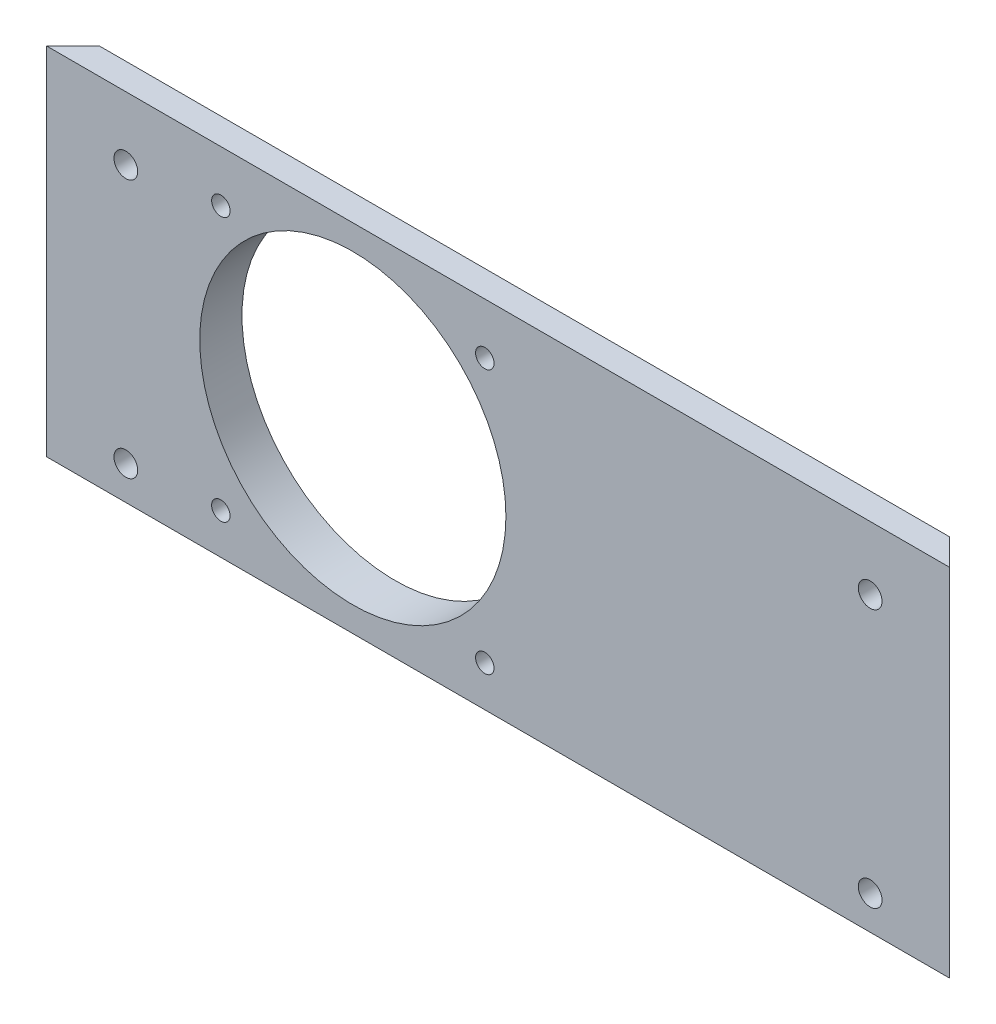
from build123d import *

# Parameters (mm, degrees)
SKETCH1_W           = 171
SKETCH1_H           = 70
SKETCH1_R           = 2.25
BOSS_EXTRUDE1_DEPTH = 5
SKETCH2_W           = 171
SKETCH2_H           = 65
SKETCH2_R           = 2.25
BOSS_EXTRUDE2_DEPTH = 3
CHAMFER1_SIZE       = 8
CHAMFER3_SIZE       = 3
SKETCH3_W           = 7.071067812
SKETCH3_H           = 2.6
CUT_EXTRUDE1_DEPTH  = 199.002168661
SKETCH4_R           = 29
SKETCH4_R_2         = 1.75
CUT_EXTRUDE2_DEPTH  = 185.945938047


with BuildPart() as part:
    # Sketch1 → Boss-Extrude1 (new body)
    with BuildSketch(Plane.XY):
        with Locations((85.5, 35)):
            Rectangle(SKETCH1_W, SKETCH1_H)
        with Locations((15, 9)):
            Circle(SKETCH1_R, mode=Mode.SUBTRACT)
        with Locations(Location((156, 9, 0), (0, 0, 180))):
            Circle(SKETCH1_R, mode=Mode.SUBTRACT)
        with Locations((15, 58)):
            Circle(SKETCH1_R, mode=Mode.SUBTRACT)
        with Locations(Location((156, 58, 0), (0, 0, 180))):
            Circle(SKETCH1_R, mode=Mode.SUBTRACT)
    extrude(amount=-BOSS_EXTRUDE1_DEPTH)

    # Sketch2 → Boss-Extrude2 (add)
    with BuildSketch(Plane(origin=(0, 0, -5), x_dir=(-1, 0, 0), z_dir=(0, 0, -1))):
        with Locations((-85.5, 37.5)):
            Rectangle(SKETCH2_W, SKETCH2_H)
        with Locations(Location((-15, 9, 0), (0, 0, 180))):
            Circle(SKETCH2_R, mode=Mode.SUBTRACT)
        with Locations((-156, 9)):
            Circle(SKETCH2_R, mode=Mode.SUBTRACT)
        with Locations(Location((-15, 58, 0), (0, 0, 180))):
            Circle(SKETCH2_R, mode=Mode.SUBTRACT)
        with Locations((-156, 58)):
            Circle(SKETCH2_R, mode=Mode.SUBTRACT)
    extrude(amount=BOSS_EXTRUDE2_DEPTH)

    # Chamfer1
    # the kernel refuses this chamfer: 8 mm, written as the material it takes off along each edge
    with BuildSketch(Plane(origin=(171, -15.573463904, -8), x_dir=(-0.9996219169112968, 0, -0.027495876610586296), z_dir=(0, 1, 0)), Plane(origin=(0, 90.573463904, -8), x_dir=(0.9996219169112968, 0, -0.027495876610586275), z_dir=(0, -1, 0))) as chamfer1_piece_1:
        Polygon((CHAMFER1_SIZE * 0.999621916911, CHAMFER1_SIZE * 0.0274958766106), (-CHAMFER1_SIZE * 0.0274958766106, CHAMFER1_SIZE * 0.999621916911), (0, 0), align=None)
    extrude(amount=106.146927807, mode=Mode.SUBTRACT)

    # Chamfer3
    chamfer3_edges = [part.edges().sort_by_distance(p)[0] for p in [
        (85.5, 70, -8),
    ]]
    chamfer(chamfer3_edges, length=CHAMFER3_SIZE)

    # Sketch3 → Cut-Extrude1 (cut, through all, along a direction that is not the sketch's normal)
    with BuildSketch(Plane(origin=(85.5, 0, -85.5), x_dir=(-0.7071067811865452, 0, -0.7071067811865498), z_dir=(0.7071067811865498, 0, -0.7071067811865452))):
        with Locations((-117.379725677, 1.3)):
            Rectangle(SKETCH3_W, SKETCH3_H)
    extrude(amount=-CUT_EXTRUDE1_DEPTH, dir=(1, 0, 0), mode=Mode.SUBTRACT)

    # Sketch4 → Cut-Extrude2 (cut, through all)
    with BuildSketch(Plane.XY):
        with Locations((58, 36.3)):
            Circle(SKETCH4_R)
        with Locations((33, 60.3)):
            Circle(SKETCH4_R_2)
        with Locations((83, 60.3)):
            Circle(SKETCH4_R_2)
        with Locations((83, 10.3)):
            Circle(SKETCH4_R_2)
        with Locations((33, 10.3)):
            Circle(SKETCH4_R_2)
    extrude(amount=-CUT_EXTRUDE2_DEPTH, mode=Mode.SUBTRACT)


solid = part.part
